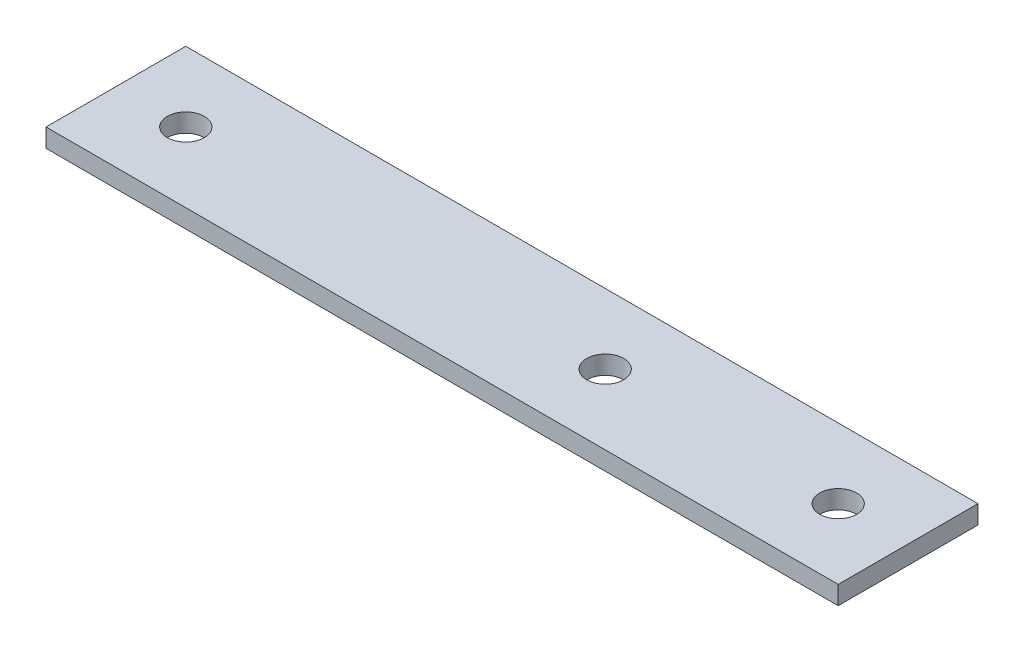
from build123d import *

# Parameters (mm, degrees)
SKETCH1_W           = 68
SKETCH1_H           = 12
SKETCH1_R           = 1.5875
BOSS_EXTRUDE1_DEPTH = 0.79375


with BuildPart() as part:
    # Sketch1 → Boss-Extrude1 (new, symmetric)
    with BuildSketch(Plane(origin=(0, 0, 0), x_dir=(1, 0, 0), z_dir=(0, 1, 0))):
        Rectangle(SKETCH1_W, SKETCH1_H)
        with Locations((-28, 0)):
            Circle(SKETCH1_R, mode=Mode.SUBTRACT)
        with Locations((28, 0)):
            Circle(SKETCH1_R, mode=Mode.SUBTRACT)
        with Locations((8, 0)):
            Circle(SKETCH1_R, mode=Mode.SUBTRACT)
    extrude(amount=BOSS_EXTRUDE1_DEPTH, both=True)


solid = part.part
